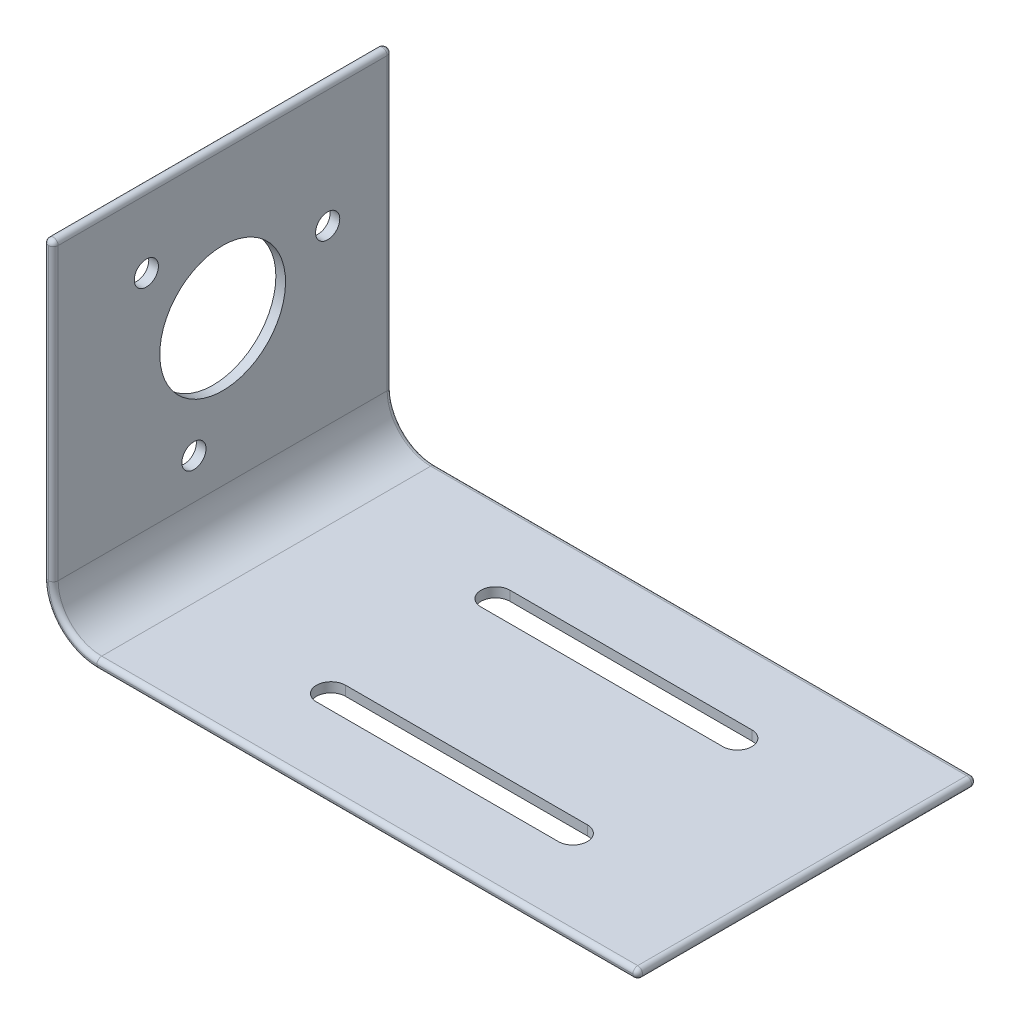
from build123d import *

# Parameters (mm, degrees)
BOSS_EXTRUDE1_DEPTH   = 35
CUT_EXTRUDE1_REACH    = 80.316
SKETCH3_R             = 6.5
FILLET1_R             = 0.5
CUT_EXTRUDE3_DEPTH    = 35
F_2_5MM_DOWEL_HOLE1_D = 2.5


with BuildPart() as part:
    # Sketch1 → Boss-Extrude1 (new body)
    with BuildSketch(Plane.XY):
        with BuildLine():
            Line((0, 0.5), (-55.4, 0.5))
            ThreePointArc((-55.4, 0.5), (-58.581980515, 1.818019485), (-59.9, 5))
            Line((-59.9, 5), (-59.9, 35))
            ThreePointArc((-59.9, 35), (-60.4, 35.5), (-60.9, 35))
            Line((-60.9, 35), (-60.9, 5))
            ThreePointArc((-60.9, 5), (-59.289087297, 1.110912703), (-55.4, -0.5))
            Line((-55.4, -0.5), (0, -0.5))
            ThreePointArc((0, -0.5), (0.5, 0), (0, 0.5))
        make_face()
    extrude(amount=BOSS_EXTRUDE1_DEPTH)

    # Sketch3 → Cut-Extrude1 (cut, up to next)
    with BuildSketch(Plane(origin=(-59.9, 0, 0), x_dir=(0, 0, -1), z_dir=(1, 0, 0)), mode=Mode.PRIVATE) as cut_extrude1_sk1:
        with Locations(Location((-17.5, 20, 0), (0, 0, 90))):
            Circle(SKETCH3_R)
    cut_extrude1_tool1 = extrude(cut_extrude1_sk1.sketch, amount=-CUT_EXTRUDE1_REACH, mode=Mode.PRIVATE) & part.part
    add(cut_extrude1_tool1.solids().sort_by_distance((-59.9, 20, 17.5))[0], mode=Mode.SUBTRACT)

    # Fillet1
    fillet1_edges = [part.edges().sort_by_distance(p)[0] for p in [
        (-60.9, 20, 0),
        (-60.4, 35.5, 0),
        (-59.9, 20, 0),
        (-58.581980515, 1.818019485, 0),
        (-60.4, 35.5, 35),
        (-60.9, 20, 35),
        (-59.289087297, 1.110912703, 35),
        (-27.7, -0.5, 35),
        (0.5, 0, 35),
        (-27.7, 0.5, 35),
        (-58.581980515, 1.818019485, 35),
        (-27.7, 0.5, 0),
        (-59.9, 20, 35),
        (0.5, 0, 0),
        (-27.7, -0.5, 0),
        (-59.289087297, 1.110912703, 0),
    ]]
    fillet(fillet1_edges, radius=FILLET1_R - 0.0001)  # a hair under: the kernel refuses the full size

    # Sketch6 → Cut-Extrude3 (cut)
    with BuildSketch(Plane(origin=(0, 0.5, 0), x_dir=(1, 0, 0), z_dir=(0, 1, 0))):
        with BuildLine():
            Line((-40.2, -7.5), (-15.2, -7.5))
            ThreePointArc((-15.2, -7.5), (-13.7, -9), (-15.2, -10.5))
            Line((-15.2, -10.5), (-40.2, -10.5))
            ThreePointArc((-40.2, -10.5), (-41.7, -9), (-40.2, -7.5))
        make_face()
        with BuildLine():
            Line((-40.2, -27.5), (-15.2, -27.5))
            ThreePointArc((-15.2, -27.5), (-13.7, -26), (-15.2, -24.5))
            Line((-15.2, -24.5), (-40.2, -24.5))
            ThreePointArc((-40.2, -24.5), (-41.7, -26), (-40.2, -27.5))
        make_face()
    extrude(amount=-CUT_EXTRUDE3_DEPTH, mode=Mode.SUBTRACT)

    # Ø2.5mm Dowel Hole1 (through all)
    with Locations(Plane(origin=(-59.9, 27.981374836, 25.385813574), x_dir=(0, 1, 0), z_dir=(1, 0, 0))):
        with Locations((0, 0), (-18.801377139, -4.916646995), (-5.14274737, -18.740793726)):
            Hole(F_2_5MM_DOWEL_HOLE1_D / 2)


solid = part.part
